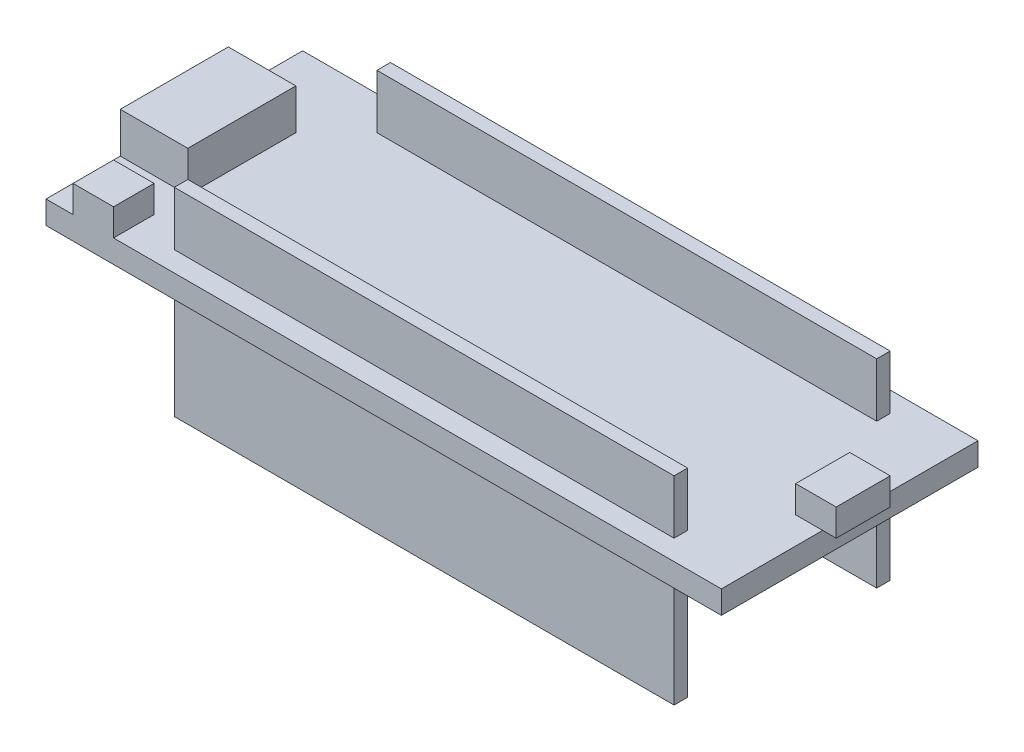
from build123d import *

# Parameters (mm, degrees)
SKETCH_1_W           = 50
SKETCH_1_H           = 19
EXTRUDE_1_DEPTH      = 1.7
SKETCH_2_W           = 5
SKETCH_2_H           = 8
EXTRUDE_2_DEPTH      = 3
SKETCH_3_W           = 3
SKETCH_3_H           = 3
EXTRUDE_3_DEPTH      = 2
EXTRUDE_4_DEPTH      = 4
EXTRUDE_4_DEPTH_BACK = 10.7
SKETCH_4_W           = 37
SKETCH_4_H           = 1
SKETCH_6_W           = 3
SKETCH_6_H           = 2
EXTRUDE_6_DEPTH      = 1
SKETCH_7_W           = 3
SKETCH_7_H           = 4
EXTRUDE_7_DEPTH      = 2


with BuildPart() as part:
    # Эскиз1 → Бобышка-Вытянуть1 (new body)
    with BuildSketch(Plane(origin=(0, 0, 0), x_dir=(1, 0, 0), z_dir=(0, 1, 0))):
        Rectangle(SKETCH_1_W, SKETCH_1_H)
    extrude(amount=EXTRUDE_1_DEPTH)

    # Эскиз2 → Бобышка-Вытянуть2 (add)
    with BuildSketch(Plane(origin=(0, 1.7, 0), x_dir=(1, 0, 0), z_dir=(0, 1, 0))):
        with Locations((-22.5, 0)):
            Rectangle(SKETCH_2_W, SKETCH_2_H)
    extrude(amount=EXTRUDE_2_DEPTH)

    # Эскиз3 → Бобышка-Вытянуть3 (add)
    with BuildSketch(Plane(origin=(0, 1.7, 0), x_dir=(1, 0, 0), z_dir=(0, 1, 0))):
        with Locations((-21.5, -8)):
            Rectangle(SKETCH_3_W, SKETCH_3_H)
    extrude(amount=EXTRUDE_3_DEPTH)

    # Эскиз4 → Бобышка-Вытянуть4 (add, two sides: drawn at the far end of the back side and taken through both)
    with BuildSketch(Plane(origin=(0, 1.7, 0), x_dir=(1, 0, 0), z_dir=(0, 1, 0)).offset(-EXTRUDE_4_DEPTH_BACK)):
        with Locations((1.5, 7.5)):
            Rectangle(SKETCH_4_W, SKETCH_4_H)
        with Locations((1.5, -7.5)):
            Rectangle(SKETCH_4_W, SKETCH_4_H)
    extrude(amount=EXTRUDE_4_DEPTH + EXTRUDE_4_DEPTH_BACK)

    # Эскиз6 → Бобышка-Вытянуть6 (add)
    with BuildSketch(Plane.XZ):
        with Locations((-23.5, 0)):
            Rectangle(SKETCH_6_W, SKETCH_6_H)
    extrude(amount=EXTRUDE_6_DEPTH)

    # Эскиз7 → Бобышка-Вытянуть7 (add)
    with BuildSketch(Plane(origin=(0, 1.7, 0), x_dir=(1, 0, 0), z_dir=(0, 1, 0))):
        with Locations((24.5, 0)):
            Rectangle(SKETCH_7_W, SKETCH_7_H)
    extrude(amount=EXTRUDE_7_DEPTH)


solid = part.part
